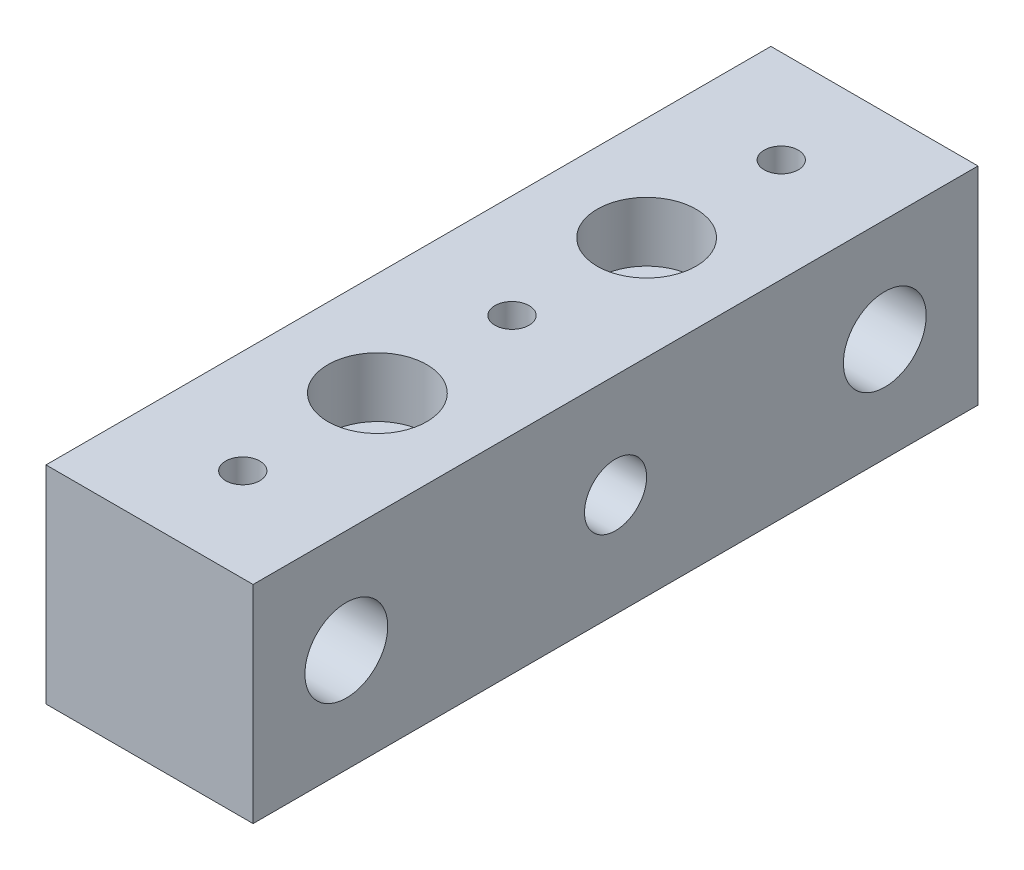
from build123d import *

# Parameters (mm, degrees)
ESBO_O1_W             = 20
ESBO_O1_H             = 70
FLANGE_BASE1_DEPTH    = 20
ESBO_O3_R             = 4.775
CORTE_EXTRUS_O1_DEPTH = 5.75
ESBO_O4_R             = 2.65
CORTE_EXTRUS_O2_DEPTH = 40.090440008
ESBO_O5_R             = 4
ESBO_O5_R_2           = 3
CORTE_EXTRUS_O3_DEPTH = 46
CORTE_EXTRUS_O5_REACH = 43.533
ESBO_O6_R             = 1.65


# Sheet-metal steps are written as plain solids
with BuildPart() as part:
    # Esboço1 → Flange-base1 (new body)
    with BuildSketch(Plane(origin=(0, 0, 0), x_dir=(1, 0, 0), z_dir=(0, 1, 0))):
        Rectangle(ESBO_O1_W, ESBO_O1_H)
    extrude(amount=-FLANGE_BASE1_DEPTH)

    # Esboço3 → Corte-extrusão1 (cut)
    with BuildSketch(Plane(origin=(0, 0, 0), x_dir=(1, 0, 0), z_dir=(0, 1, 0))):
        with Locations(Location((0, 13, 0), (0, 0, 270))):
            Circle(ESBO_O3_R)
        with Locations(Location((0, -13, 0), (0, 0, 270))):
            Circle(ESBO_O3_R)
    extrude(amount=-CORTE_EXTRUS_O1_DEPTH, mode=Mode.SUBTRACT)

    # Esboço4 → Corte-extrusão2 (cut, through all)
    with BuildSketch(Plane(origin=(0, -5.75, 0), x_dir=(1, 0, 0), z_dir=(0, 1, 0))):
        with Locations(Location((0, 13, 0), (0, 0, 270))):
            Circle(ESBO_O4_R)
        with Locations(Location((0, -13, 0), (0, 0, 270))):
            Circle(ESBO_O4_R)
    extrude(amount=-CORTE_EXTRUS_O2_DEPTH, mode=Mode.SUBTRACT)

    # Esboço5 → Corte-extrusão3 (cut, through all)
    with BuildSketch(Plane(origin=(10, 0, 0), x_dir=(0, 0, -1), z_dir=(1, 0, 0))):
        with Locations((-26, -10)):
            Circle(ESBO_O5_R)
        with Locations((26, -10)):
            Circle(ESBO_O5_R)
        with Locations((0, -10)):
            Circle(ESBO_O5_R_2)
    extrude(amount=-CORTE_EXTRUS_O3_DEPTH, mode=Mode.SUBTRACT)

    # Esboço6 → Corte-extrusão5 (cut, up to next)
    with BuildSketch(Plane(origin=(0, 0, 0), x_dir=(1, 0, 0), z_dir=(0, 1, 0)), mode=Mode.PRIVATE) as corte_extrus_o5_sk1:
        with Locations(Location((0, -26, 0), (0, 0, 270))):
            Circle(ESBO_O6_R)
    corte_extrus_o5_tool1 = extrude(corte_extrus_o5_sk1.sketch, amount=-CORTE_EXTRUS_O5_REACH, mode=Mode.PRIVATE) & part.part
    # Esboço6 → Corte-extrusão5 (cut, up to next)
    with BuildSketch(Plane(origin=(0, 0, 0), x_dir=(1, 0, 0), z_dir=(0, 1, 0)), mode=Mode.PRIVATE) as corte_extrus_o5_sk2:
        with Locations(Location((0, 26, 0), (0, 0, 270))):
            Circle(ESBO_O6_R)
    corte_extrus_o5_tool2 = extrude(corte_extrus_o5_sk2.sketch, amount=-CORTE_EXTRUS_O5_REACH, mode=Mode.PRIVATE) & part.part
    # Esboço6 → Corte-extrusão5 (cut, up to next)
    with BuildSketch(Plane(origin=(0, 0, 0), x_dir=(1, 0, 0), z_dir=(0, 1, 0)), mode=Mode.PRIVATE) as corte_extrus_o5_sk3:
        with Locations(Location((0, 0, 0), (0, 0, 270))):
            Circle(ESBO_O6_R)
    corte_extrus_o5_tool3 = extrude(corte_extrus_o5_sk3.sketch, amount=-CORTE_EXTRUS_O5_REACH, mode=Mode.PRIVATE) & part.part
    add(corte_extrus_o5_tool1.solids().sort_by_distance((0, 0, 26))[0], mode=Mode.SUBTRACT)
    add(corte_extrus_o5_tool2.solids().sort_by_distance((0, 0, -26))[0], mode=Mode.SUBTRACT)
    add(corte_extrus_o5_tool3.solids().sort_by_distance((0, 0, 0))[0], mode=Mode.SUBTRACT)


solid = part.part
